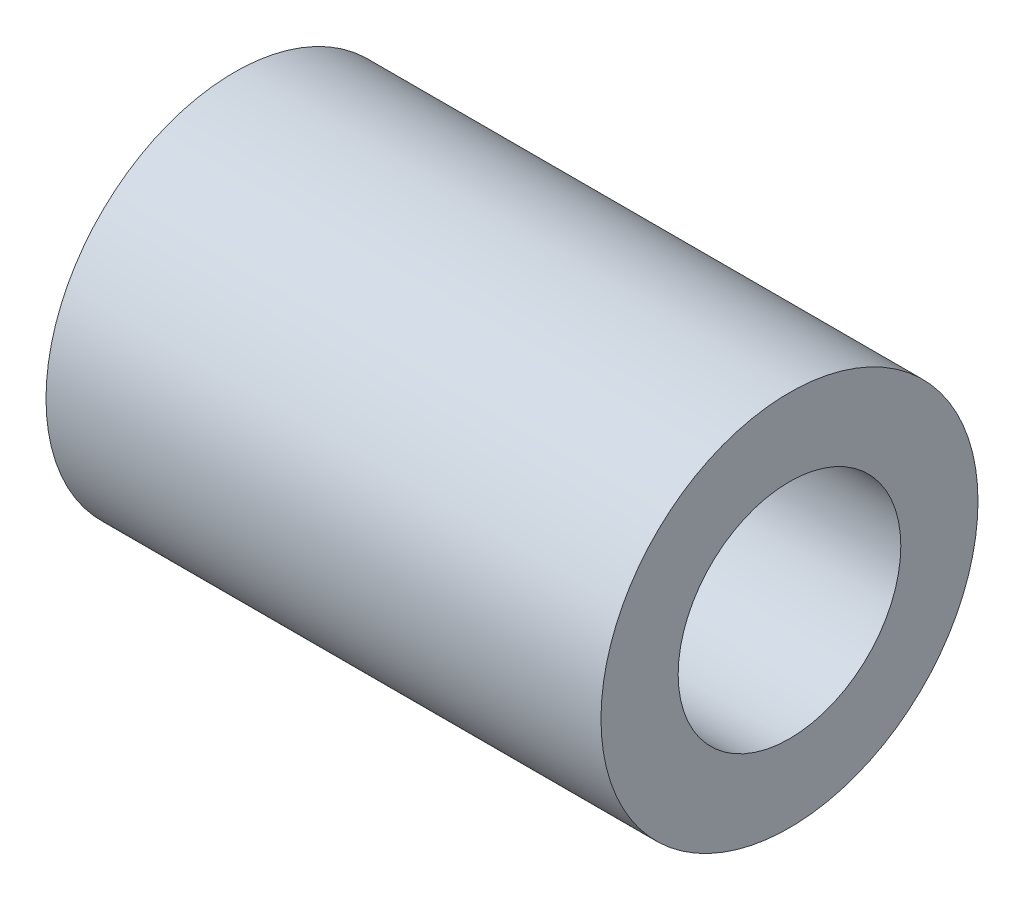
from build123d import *

# Parameters (mm, degrees)
SKETCH1_R           = 5.08
SKETCH1_R_2         = 3.175
BOSS_EXTRUDE1_DEPTH = 3.175
BOSS_EXTRUDE2_START = 11.78052
SKETCH1_3_R         = 5.08
SKETCH1_3_R_2       = 3
BOSS_EXTRUDE2_DEPTH = 11.78052


with BuildPart() as part:
    # Sketch1 → Boss-Extrude1 (new body)
    with BuildSketch(Plane(origin=(0, 0, 0), x_dir=(0, 0, -1), z_dir=(1, 0, 0))):
        Circle(SKETCH1_R)
        Circle(SKETCH1_R_2, mode=Mode.SUBTRACT)
    extrude(amount=-BOSS_EXTRUDE1_DEPTH)

    # Sketch1<3> → Boss-Extrude2 (add)
    with BuildSketch(Plane(origin=(0, 0, 0), x_dir=(0, 0, -1), z_dir=(1, 0, 0)).offset(BOSS_EXTRUDE2_START)):
        Circle(SKETCH1_3_R)
        Circle(SKETCH1_3_R_2, mode=Mode.SUBTRACT)
    extrude(amount=-BOSS_EXTRUDE2_DEPTH)


solid = part.part
